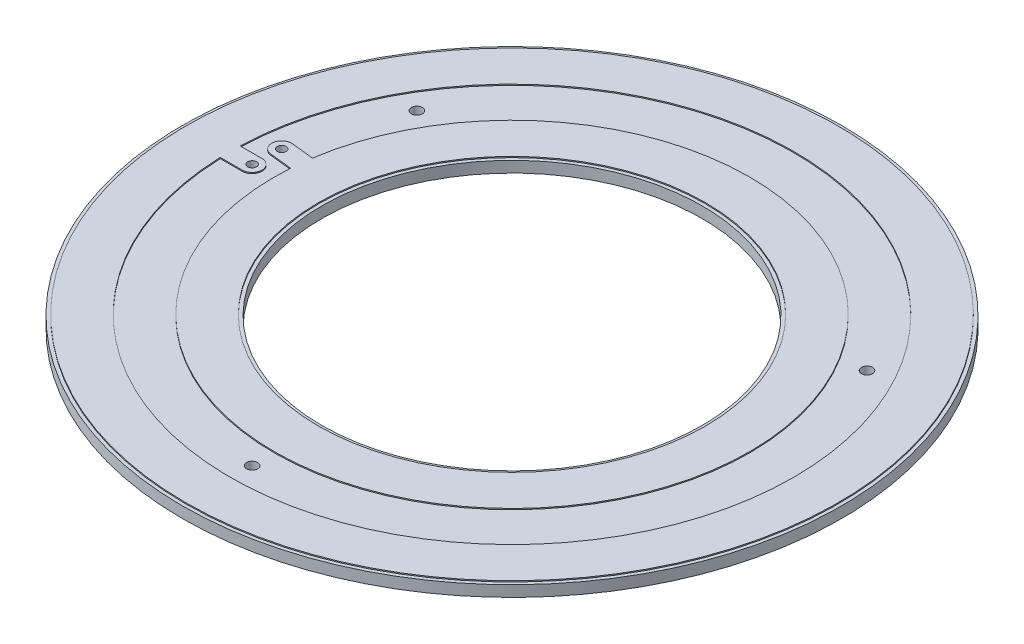
from build123d import *

# Parameters (mm, degrees)
SKETCH_1_R               = 29.8
SKETCH_1_R_2             = 17.2
EXTRUDE_1_DEPTH          = 1
SKETCH_2_R               = 29.5
SKETCH_2_R_2             = 25.5
SKETCH_2_R_3             = 21.5
SKETCH_2_R_4             = 17.5
EXTRUDE_2_DEPTH          = 0.1
SKETCH_4_R               = 0.4
CUT_EXTRUDE_1_DEPTH      = 43.155426697
EXTRUDE_START            = 0.1
SKETCH_5_R               = 0.9
SKETCH_5_R_2             = 0.4
EXTRUDE_3_DEPTH          = 0.1
EXTRUDE_4_DEPTH          = 0.1
SKETCH_7_R               = 0.5
CUT_EXTRUDE_2_DEPTH      = 10
PATTERN_CIRCULAR_1_COUNT = 3


with BuildPart() as part:
    # Эскиз1 → Бобышка-Вытянуть1 (new body)
    with BuildSketch(Plane(origin=(0, 0, 0), x_dir=(1, 0, 0), z_dir=(0, 1, 0))):
        Circle(SKETCH_1_R)
        Circle(SKETCH_1_R_2, mode=Mode.SUBTRACT)
    extrude(amount=EXTRUDE_1_DEPTH)

    # Эскиз2 → Бобышка-Вытянуть2 (add)
    # profile 1 of 2: a face of its own
    with BuildSketch(Plane(origin=(0, 1, 0), x_dir=(1, 0, 0), z_dir=(0, 1, 0))):
        Circle(SKETCH_2_R)
        Circle(SKETCH_2_R_2, mode=Mode.SUBTRACT)
    # profile 2 of 2: a face of its own
    with BuildSketch(Plane(origin=(0, 1, 0), x_dir=(1, 0, 0), z_dir=(0, 1, 0))):
        Circle(SKETCH_2_R_3)
        Circle(SKETCH_2_R_4, mode=Mode.SUBTRACT)
    extrude(amount=EXTRUDE_2_DEPTH)

    # Эскиз4 → Вырез-Вытянуть1 (cut, through all)
    with BuildSketch(Plane(origin=(0, 1, 0), x_dir=(1, 0, 0), z_dir=(0, 1, 0))):
        with Locations((-23.5, 0)):
            Circle(SKETCH_4_R)
        with Locations((-23.362328651, 2.54)):
            Circle(SKETCH_4_R)
    extrude(amount=-CUT_EXTRUDE_1_DEPTH, mode=Mode.SUBTRACT)

    # Эскиз5 → Бобышка-Вытянуть3 (add)
    # profile 1 of 2: a face of its own
    with BuildSketch(Plane(origin=(0, 1, 0), x_dir=(1, 0, 0), z_dir=(0, 1, 0)).offset(EXTRUDE_START)):
        with Locations((-23.362328651, 2.54)):
            Circle(SKETCH_5_R)
        with Locations((-23.362328651, 2.54)):
            Circle(SKETCH_5_R_2, mode=Mode.SUBTRACT)
    # profile 2 of 2: a face of its own
    with BuildSketch(Plane(origin=(0, 1, 0), x_dir=(1, 0, 0), z_dir=(0, 1, 0)).offset(EXTRUDE_START)):
        with Locations((-23.5, 0)):
            Circle(SKETCH_5_R)
        with Locations((-23.5, 0)):
            Circle(SKETCH_5_R_2, mode=Mode.SUBTRACT)
    extrude(amount=-EXTRUDE_3_DEPTH)

    # Эскиз6 → Бобышка-Вытянуть4 (add)
    with BuildSketch(Plane(origin=(0, 1, 0), x_dir=(1, 0, 0), z_dir=(0, 1, 0))):
        Polygon((-23.5, -0.9), (-27.456522895, -0.9), (-27.456522895, 0.9), (-23.5, 0.9), (-24.110773747, 0), align=None)
        Polygon((-23.362328651, 1.64), (-20.018109834, 1.276409712), (-19.824696405, 3.05538141), (-23.168915221, 3.418971698), (-22.768010698, 2.47538454), align=None)
    extrude(amount=EXTRUDE_4_DEPTH)

    # Эскиз7 → Вырез-Вытянуть2 (cut)
    with BuildSketch(Plane(origin=(0, 1, 0), x_dir=(1, 0, 0), z_dir=(0, 1, 0))):
        with Locations((0, -23.5)):
            Circle(SKETCH_7_R)
    cut_extrude_2 = extrude(amount=-CUT_EXTRUDE_2_DEPTH, mode=Mode.SUBTRACT)

    # Круговой массив1: Вырез-Вытянуть2 ×3 about axis
    pattern_circular_1_axis = Axis((0, 1, 0), (0, -1, 0))
    for i in range(1, PATTERN_CIRCULAR_1_COUNT):
        add(cut_extrude_2.rotate(pattern_circular_1_axis, i * 360 / PATTERN_CIRCULAR_1_COUNT), mode=Mode.SUBTRACT)


solid = part.part
